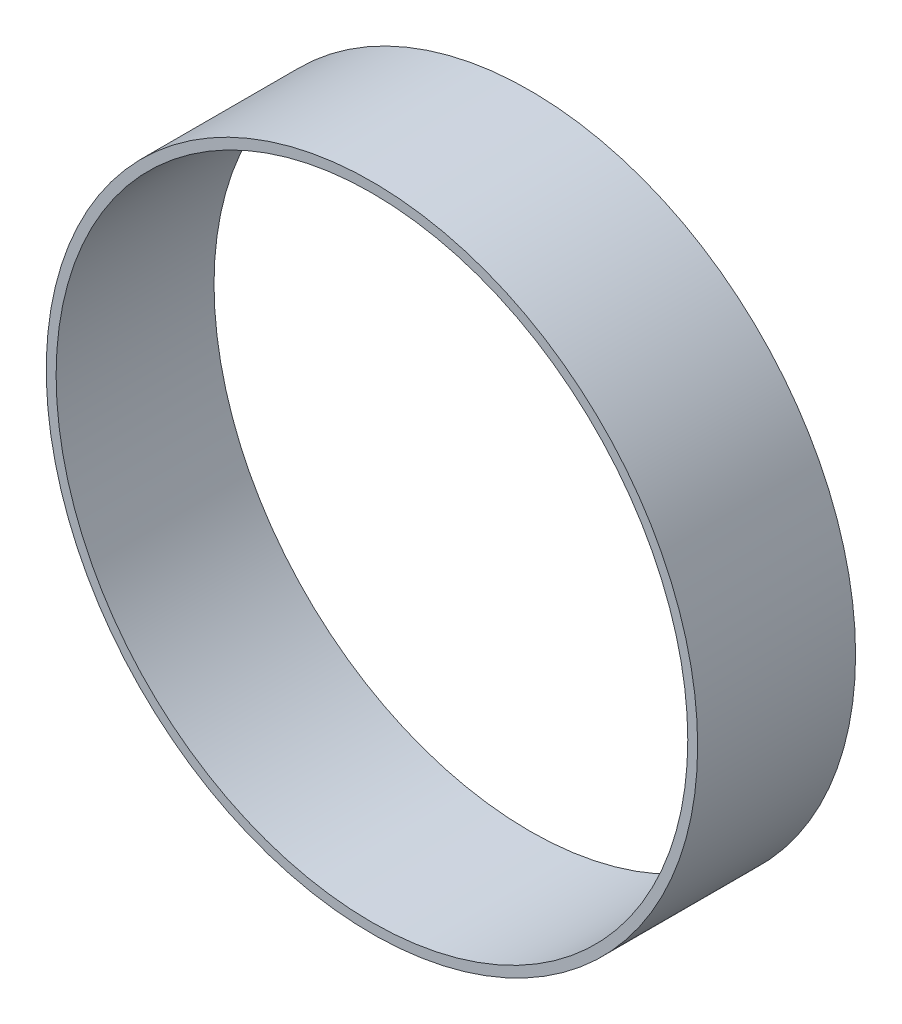
from build123d import *

# Parameters (mm, degrees)
SKETCH1_R           = 104.775
SKETCH1_R_2         = 101.6
BOSS_EXTRUDE1_DEPTH = 50.8


with BuildPart() as part:
    # Sketch1 → Boss-Extrude1 (new body)
    with BuildSketch(Plane(origin=(0, 0, 0), x_dir=(0, 1, 0), z_dir=(0, 0, 1))):
        Circle(SKETCH1_R)
        Circle(SKETCH1_R_2, mode=Mode.SUBTRACT)
    extrude(amount=BOSS_EXTRUDE1_DEPTH)


solid = part.part
